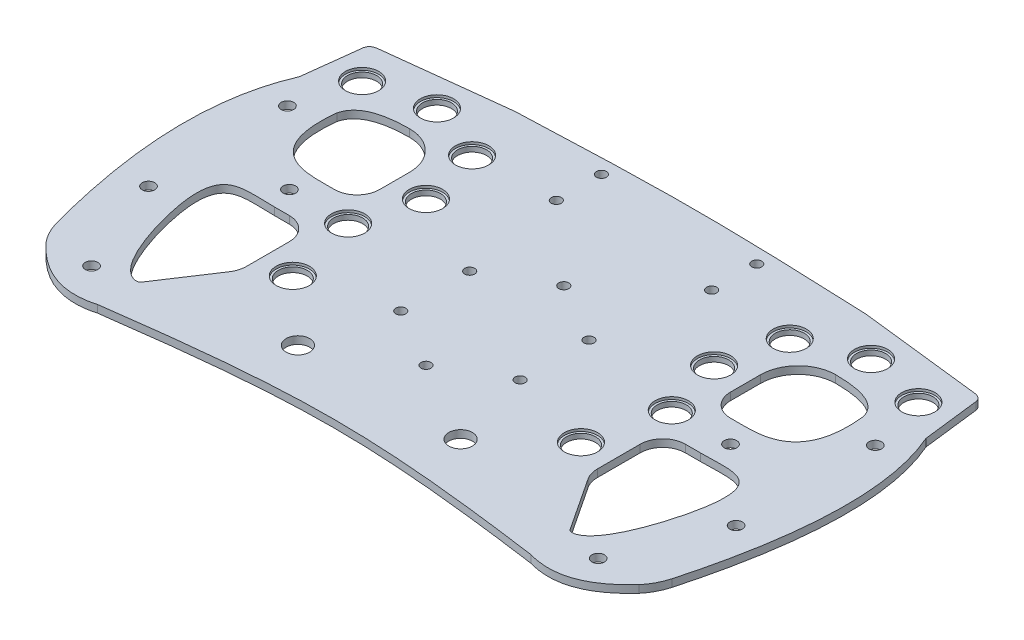
from build123d import *

# Parameters (mm, degrees)
BOSS_EXTRUDE1_OUTLINE_R   = 2.5
BOSS_EXTRUDE1_OUTLINE_R_2 = 4.7
BOSS_EXTRUDE1_OUTLINE_R_3 = 5.8
BOSS_EXTRUDE1_OUTLINE_R_4 = 2
BOSS_EXTRUDE1_DEPTH       = 3
SKETCH3_R                 = 1.5
CUT_EXTRUDE1_DEPTH        = 2
SKETCH4_R                 = 6.65
CUT_EXTRUDE3_DEPTH        = 1


# Read off the part's stored shape, not the designer's step: Boss-Extrude1
with BuildPart() as part:
    # Boss-Extrude1 outline → Boss-Extrude1 (new body)
    with BuildSketch(Plane(origin=(0, 0, 0), x_dir=(1, 0, 0), z_dir=(0, 1, 0))):
        with BuildLine():
            Line((-70, 78), (-119.123426788, 72.331912294))
            add(Edge.make_bspline(
                [(-119.123426788, 72.331912294), (-121.817313074, 72.000000019), (-122.273896674, 69.717527721)],
                knots=[0.016356922, 0.016356922, 0.016356922, 0.873306336, 0.873306336, 0.873306336], degree=2))
            Line((-122.273896674, 69.717527721), (-125, 47))
            add(Edge.make_bspline(
                [(-125, 47), (-140.310843166, 12.049240253), (-122.843906966, -52.183993971)],
                knots=[0, 0, 0, 0.96415889, 0.96415889, 0.96415889], degree=2))
            add(Edge.make_bspline(
                [(-122.843906966, -52.183993971), (-121.5, -57), (-118.282004102, -60.826813609)],
                knots=[0, 0, 0, 1, 1, 1], degree=2))
            add(Edge.make_bspline(
                [(-118.282004102, -60.826813609), (-103.606996493, -76.952025301), (-86.5, -72)],
                knots=[0.099631764, 0.099631764, 0.099631764, 1, 1, 1], degree=2))
            add(Edge.make_bspline(
                [(-86.5, -72), (0, -60), (86.5, -72)],
                knots=[0, 0, 0, 1, 1, 1], degree=2, weights=[1, 1.666666667, 1]))
            add(Edge.make_bspline(
                [(118.282004106, -60.826813605), (103.606996495, -76.952025301), (86.5, -72)],
                knots=[0.099631763, 0.099631763, 0.099631763, 1, 1, 1], degree=2))
            add(Edge.make_bspline(
                [(122.843906966, -52.183993971), (121.5, -57), (118.282004106, -60.826813605)],
                knots=[0, 0, 0, 1, 1, 1], degree=2))
            add(Edge.make_bspline(
                [(125, 47), (140.310843171, 12.049240242), (122.843906966, -52.183993971)],
                knots=[0, 0, 0, 0.96415889, 0.96415889, 0.96415889], degree=2))
            Line((125, 47), (122.273896674, 69.717527721))
            add(Edge.make_bspline(
                [(119.123426788, 72.331912294), (121.817313074, 72.000000019), (122.273896674, 69.717527721)],
                knots=[0.016356922, 0.016356922, 0.016356922, 0.873306336, 0.873306336, 0.873306336], degree=2))
            Line((119.123426788, 72.331912294), (70, 78))
            add(Edge.make_bspline(
                [(-70, 78), (0, 81), (70, 78)],
                knots=[0, 0, 0, 1, 1, 1], degree=2, weights=[1, 1.857142857, 1]))
        make_face()
        with Locations((-101.086868344, -59.874042945)):
            Circle(BOSS_EXTRUDE1_OUTLINE_R, mode=Mode.SUBTRACT)
        with Locations((-32.460031949, -46.153127094)):
            Circle(BOSS_EXTRUDE1_OUTLINE_R_2, mode=Mode.SUBTRACT)
        with Locations((-117.25, -21)):
            Circle(BOSS_EXTRUDE1_OUTLINE_R, mode=Mode.SUBTRACT)
        with BuildLine():
            Line((-70, -12), (-70, -29))
            add(Edge.make_bspline(
                [(-70, -29), (-70, -31.999987298), (-71.652526625, -34.50382822)],
                knots=[0, 0, 0, 1, 1, 1], degree=2))
            Line((-71.652526625, -34.50382822), (-85.673736688, -55.74808589))
            add(Edge.make_bspline(
                [(-85, -3), (-99, -3), (-112, 0), (-108, -8.5), (-105, -31), (-98, -49), (-94.5, -57), (-86.500030089, -57), (-85.673736688, -55.74808589)],
                knots=[0, 0, 0, 0, 0, 0, 0, 0, 0, 1, 1, 1, 1, 1, 1, 1, 1, 1], degree=8))
            Line((-85, -3), (-79, -3))
            ThreePointArc((-79, -3), (-72.636038969, -5.636038969), (-70, -12))
        make_face(mode=Mode.SUBTRACT)
        with Locations((-57.5, -23.153127094)):
            Circle(BOSS_EXTRUDE1_OUTLINE_R_3, mode=Mode.SUBTRACT)
        with Locations((0, -27.5)):
            Circle(BOSS_EXTRUDE1_OUTLINE_R_4, mode=Mode.SUBTRACT)
        with Locations((-23.815698604, -13.75)):
            Circle(BOSS_EXTRUDE1_OUTLINE_R_4, mode=Mode.SUBTRACT)
        with Locations((32.460031949, -46.153127094)):
            Circle(BOSS_EXTRUDE1_OUTLINE_R_2, mode=Mode.SUBTRACT)
        with Locations((101.086868344, -59.874042945)):
            Circle(BOSS_EXTRUDE1_OUTLINE_R, mode=Mode.SUBTRACT)
        with Locations((57.5, -23.153127094)):
            Circle(BOSS_EXTRUDE1_OUTLINE_R_3, mode=Mode.SUBTRACT)
        with Locations((23.815698604, -13.75)):
            Circle(BOSS_EXTRUDE1_OUTLINE_R_4, mode=Mode.SUBTRACT)
        with BuildLine():
            add(Edge.make_bspline(
                [(85, -3), (99, -3), (112, 0), (108, -8.5), (105, -31), (98, -49), (94.5, -57), (86.500030089, -57), (85.673736688, -55.74808589)],
                knots=[0, 0, 0, 0, 0, 0, 0, 0, 0, 1, 1, 1, 1, 1, 1, 1, 1, 1], degree=8))
            Line((85.673736688, -55.74808589), (71.652526625, -34.50382822))
            add(Edge.make_bspline(
                [(70, -29), (70, -31.999987298), (71.652526625, -34.50382822)],
                knots=[0, 0, 0, 1, 1, 1], degree=2))
            Line((70, -29), (70, -12))
            ThreePointArc((70, -12), (72.636038969, -5.636038969), (79, -3))
            Line((79, -3), (85, -3))
        make_face(mode=Mode.SUBTRACT)
        with Locations((117.25, -21)):
            Circle(BOSS_EXTRUDE1_OUTLINE_R, mode=Mode.SUBTRACT)
        with Locations((-88, 6)):
            Circle(BOSS_EXTRUDE1_OUTLINE_R, mode=Mode.SUBTRACT)
        with Locations((-117.3, 34.5)):
            Circle(BOSS_EXTRUDE1_OUTLINE_R, mode=Mode.SUBTRACT)
        with BuildLine():
            add(Edge.make_bspline(
                [(-105, 42), (-108, 15), (-92, 15), (-83.5, 15)],
                knots=[0, 0, 0, 0, 1, 1, 1, 1], degree=3))
            add(Edge.make_bspline(
                [(-85, 51), (-102.75, 51), (-105, 42)],
                knots=[0, 0, 0, 1, 1, 1], degree=2))
            ThreePointArc((-85, 51), (-74.393398282, 46.606601718), (-70, 36))
            Line((-70, 36), (-70, 24))
            ThreePointArc((-70, 24), (-72.636038969, 17.636038969), (-79, 15))
            Line((-79, 15), (-83.5, 15))
        make_face(mode=Mode.SUBTRACT)
        with Locations((-64.577794898, 6)):
            Circle(BOSS_EXTRUDE1_OUTLINE_R_3, mode=Mode.SUBTRACT)
        with Locations((-23.815698604, 13.75)):
            Circle(BOSS_EXTRUDE1_OUTLINE_R_4, mode=Mode.SUBTRACT)
        with Locations((-57.5, 29.977172881)):
            Circle(BOSS_EXTRUDE1_OUTLINE_R_3, mode=Mode.SUBTRACT)
        with Locations((0, 27.5)):
            Circle(BOSS_EXTRUDE1_OUTLINE_R_4, mode=Mode.SUBTRACT)
        with Locations((-111, 58)):
            Circle(BOSS_EXTRUDE1_OUTLINE_R_3, mode=Mode.SUBTRACT)
        with Locations((-86.612529585, 63.500116978)):
            Circle(BOSS_EXTRUDE1_OUTLINE_R_3, mode=Mode.SUBTRACT)
        with Locations((-63.376133298, 54.276783114)):
            Circle(BOSS_EXTRUDE1_OUTLINE_R_3, mode=Mode.SUBTRACT)
        with Locations((-31, 55.5)):
            Circle(BOSS_EXTRUDE1_OUTLINE_R_4, mode=Mode.SUBTRACT)
        with Locations((-31, 73.5)):
            Circle(BOSS_EXTRUDE1_OUTLINE_R_4, mode=Mode.SUBTRACT)
        with Locations((23.815698604, 13.75)):
            Circle(BOSS_EXTRUDE1_OUTLINE_R_4, mode=Mode.SUBTRACT)
        with Locations((64.577794898, 6)):
            Circle(BOSS_EXTRUDE1_OUTLINE_R_3, mode=Mode.SUBTRACT)
        with Locations((57.5, 29.977172881)):
            Circle(BOSS_EXTRUDE1_OUTLINE_R_3, mode=Mode.SUBTRACT)
        with Locations((88, 6)):
            Circle(BOSS_EXTRUDE1_OUTLINE_R, mode=Mode.SUBTRACT)
        with BuildLine():
            ThreePointArc((70, 36), (74.393398282, 46.606601718), (85, 51))
            add(Edge.make_bspline(
                [(85, 51), (102.75, 51), (105, 42)],
                knots=[0, 0, 0, 1, 1, 1], degree=2))
            add(Edge.make_bspline(
                [(105, 42), (108, 15), (92, 15), (83.5, 15)],
                knots=[0, 0, 0, 0, 1, 1, 1, 1], degree=3))
            Line((83.5, 15), (79, 15))
            ThreePointArc((79, 15), (72.636038969, 17.636038969), (70, 24))
            Line((70, 24), (70, 36))
        make_face(mode=Mode.SUBTRACT)
        with Locations((117.3, 34.5)):
            Circle(BOSS_EXTRUDE1_OUTLINE_R, mode=Mode.SUBTRACT)
        with Locations((31, 55.5)):
            Circle(BOSS_EXTRUDE1_OUTLINE_R_4, mode=Mode.SUBTRACT)
        with Locations((63.376133298, 54.276783114)):
            Circle(BOSS_EXTRUDE1_OUTLINE_R_3, mode=Mode.SUBTRACT)
        with Locations((31, 73.5)):
            Circle(BOSS_EXTRUDE1_OUTLINE_R_4, mode=Mode.SUBTRACT)
        with Locations((111, 58)):
            Circle(BOSS_EXTRUDE1_OUTLINE_R_3, mode=Mode.SUBTRACT)
        with Locations((86.612529585, 63.500116978)):
            Circle(BOSS_EXTRUDE1_OUTLINE_R_3, mode=Mode.SUBTRACT)
    extrude(amount=BOSS_EXTRUDE1_DEPTH)

    # Sketch3 → Cut-Extrude1 (cut)
    with BuildSketch(Plane.XZ):
        with Locations(Location((-25.085243816, 42.803127094, 0), (0, 0, 270))):
            Circle(SKETCH3_R)
        with Locations(Location((39.834820081, 42.803127094, 0), (0, 0, 270))):
            Circle(SKETCH3_R)
    extrude(amount=-CUT_EXTRUDE1_DEPTH, mode=Mode.SUBTRACT)

    # Sketch4 → Cut-Extrude3 (cut)
    with BuildSketch(Plane(origin=(0, 3, 0), x_dir=(1, 0, 0), z_dir=(0, 1, 0))):
        with Locations(Location((-57.5, 29.977172881, 0), (0, 0, 270))):
            Circle(SKETCH4_R)
        with Locations(Location((-63.376133298, 54.276783114, 0), (0, 0, 270))):
            Circle(SKETCH4_R)
        with Locations(Location((-86.612529585, 63.500116978, 0), (0, 0, 270))):
            Circle(SKETCH4_R)
        with Locations(Location((-111, 58, 0), (0, 0, 270))):
            Circle(SKETCH4_R)
        with Locations(Location((-64.577794898, 6, 0), (0, 0, 270))):
            Circle(SKETCH4_R)
        with Locations(Location((-57.5, -23.153127094, 0), (0, 0, 270))):
            Circle(SKETCH4_R)
        with Locations(Location((57.5, -23.153127094, 0), (0, 0, 90))):
            Circle(SKETCH4_R)
        with Locations(Location((64.577794898, 6, 0), (0, 0, 90))):
            Circle(SKETCH4_R)
        with Locations(Location((111, 58, 0), (0, 0, 90))):
            Circle(SKETCH4_R)
        with Locations(Location((86.612529585, 63.500116978, 0), (0, 0, 90))):
            Circle(SKETCH4_R)
        with Locations(Location((63.376133298, 54.276783114, 0), (0, 0, 90))):
            Circle(SKETCH4_R)
        with Locations(Location((57.5, 29.977172881, 0), (0, 0, 90))):
            Circle(SKETCH4_R)
    extrude(amount=-CUT_EXTRUDE3_DEPTH, mode=Mode.SUBTRACT)


solid = part.part
